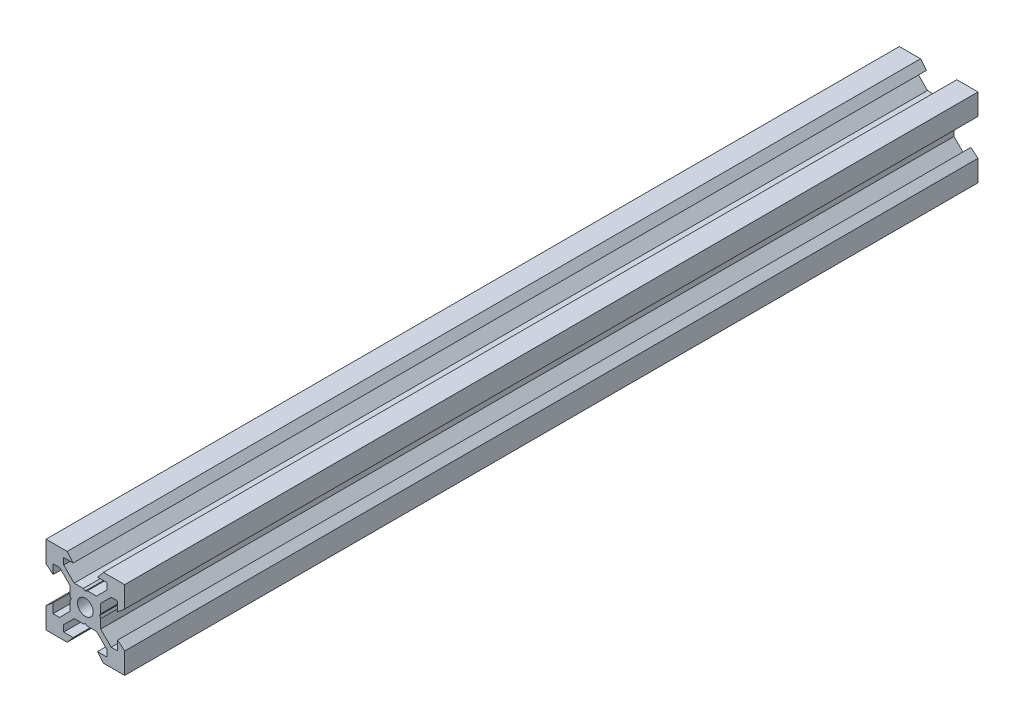
from build123d import *

# Parameters (mm, degrees)
SKETCH1_R           = 2
BOSS_EXTRUDE1_DEPTH = 108.445


with BuildPart() as part:
    # Sketch1 → Boss-Extrude1 (new, symmetric)
    with BuildSketch(Plane.XY):
        Polygon((10, 4.610379336), (10, 10), (4.610379336, 10), (3.1, 8.2), (5.5, 8.2), (5.5, 6.560660172), (2.839339828, 3.9), (0.519615242, 3.9), (0, 3.6), (-0.519615242, 3.9), (-2.839339828, 3.9), (-5.5, 6.560660172), (-5.5, 8.2), (-3.1, 8.2), (-4.610379336, 10), (-10, 10), (-10, 4.610379336), (-8.2, 3.1), (-8.2, 5.5), (-6.560660172, 5.5), (-3.9, 2.839339828), (-3.9, 0.519615242), (-3.6, 0), (-3.9, -0.519615242), (-3.9, -2.839339828), (-6.560660172, -5.5), (-8.2, -5.5), (-8.2, -3.1), (-10, -4.610379336), (-10, -10), (-4.610379336, -10), (-3.1, -8.2), (-5.5, -8.2), (-5.5, -6.560660172), (-2.839339828, -3.9), (-0.519615242, -3.9), (0, -3.6), (0.519615242, -3.9), (2.839339828, -3.9), (5.5, -6.560660172), (5.5, -8.2), (3.1, -8.2), (4.610379336, -10), (10, -10), (10, -4.610379336), (8.2, -3.1), (8.2, -5.5), (6.560660172, -5.5), (3.9, -2.839339828), (3.9, -0.519615242), (3.6, 0), (3.9, 0.519615242), (3.9, 2.839339828), (6.560660172, 5.5), (8.2, 5.5), (8.2, 3.1), align=None)
        Circle(SKETCH1_R, mode=Mode.SUBTRACT)
    extrude(amount=BOSS_EXTRUDE1_DEPTH, both=True)


solid = part.part
